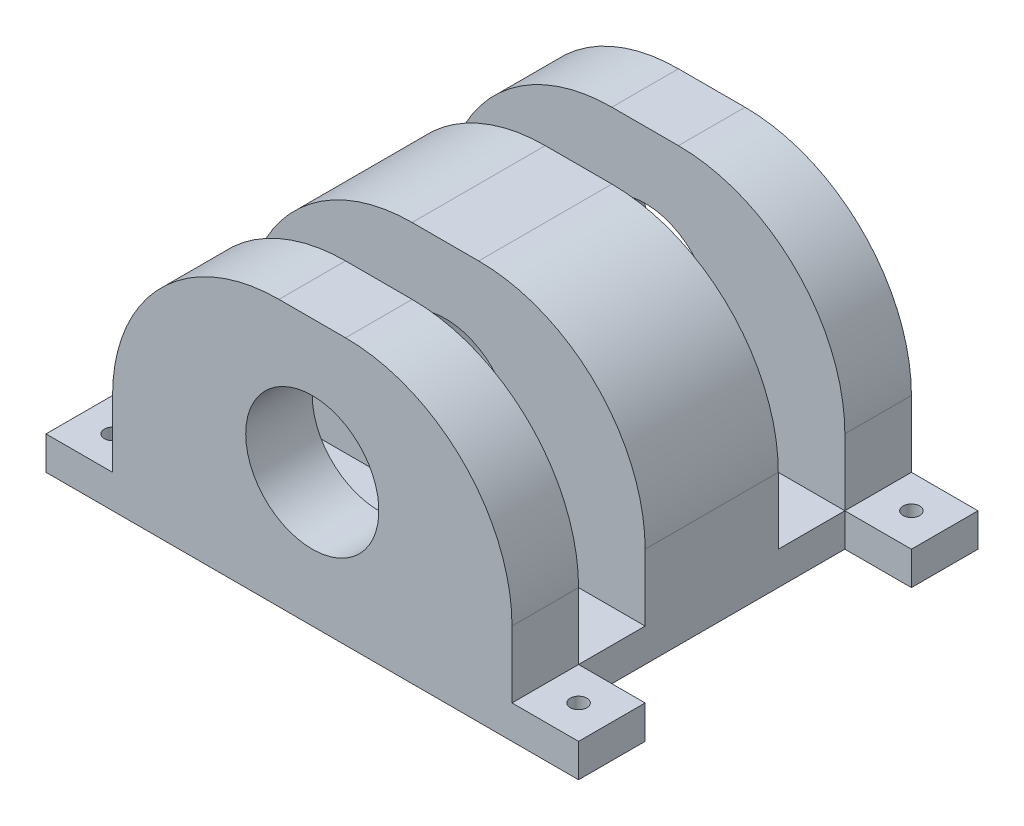
from build123d import *

# Parameters (mm, degrees)
SKETCH1_R                   = 25.4
BOSS_EXTRUDE1_DEPTH         = 152.4
CUT_EXTRUDE1_DEPTH          = 191.076195248
CUT_EXTRUDE1_DEPTH_BACK     = 191.076195248
SKETCH3_W                   = 25.4
SKETCH3_H                   = 88.9
F_1_4_0_25_DIAMETER_HOLE1_D = 6.35
SKETCH4_W                   = 25.4
SKETCH4_H                   = 101.6
CUT_EXTRUDE2_DEPTH          = 204.596488182


with BuildPart() as part:
    # Sketch1 → Boss-Extrude1 (new body)
    with BuildSketch(Plane.XY):
        with BuildLine():
            Line((-76.2, -50.8), (76.2, -50.8))
            Line((76.2, -50.8), (101.6, -50.8))
            Line((101.6, -50.8), (101.6, -38.1))
            Line((101.6, -38.1), (76.2, -38.1))
            Line((76.2, -38.1), (76.2, -12.7))
            ThreePointArc((76.2, -12.7), (57.601280605, 32.201280605), (12.7, 50.8))
            Line((12.7, 50.8), (-12.7, 50.8))
            ThreePointArc((-12.7, 50.8), (-57.601280605, 32.201280605), (-76.2, -12.7))
            Line((-76.2, -12.7), (-76.2, -38.1))
            Line((-76.2, -38.1), (-101.6, -38.1))
            Line((-101.6, -38.1), (-101.6, -50.8))
            Line((-101.6, -50.8), (-76.2, -50.8))
        make_face()
        Circle(SKETCH1_R, mode=Mode.SUBTRACT)
    extrude(amount=BOSS_EXTRUDE1_DEPTH)

    # Sketch3 → Cut-Extrude1 (cut, two sides: drawn at the far end of the back side and taken through both)
    with BuildSketch(Plane(origin=(0, 0, 0), x_dir=(0, 0, -1), z_dir=(1, 0, 0)).offset(-CUT_EXTRUDE1_DEPTH_BACK)):
        with Locations((-114.3, 6.35)):
            Rectangle(SKETCH3_W, SKETCH3_H)
        with Locations((-38.1, 6.35)):
            Rectangle(SKETCH3_W, SKETCH3_H)
    extrude(amount=CUT_EXTRUDE1_DEPTH + CUT_EXTRUDE1_DEPTH_BACK, mode=Mode.SUBTRACT)

    # 1/4 (0.25) Diameter Hole1 (through all)
    with Locations(Plane(origin=(0, -38.1, 0), x_dir=(1, 0, 0), z_dir=(0, 1, 0))):
        with Locations((-88.9, -12.7), (-88.9, -139.7), (88.9, -12.7), (88.9, -139.7)):
            Hole(F_1_4_0_25_DIAMETER_HOLE1_D / 2)

    # Sketch4 → Cut-Extrude2 (cut, through all)
    with BuildSketch(Plane(origin=(0, -38.1, 0), x_dir=(1, 0, 0), z_dir=(0, 1, 0))):
        with Locations((-88.9, -76.2)):
            Rectangle(SKETCH4_W, SKETCH4_H)
        with Locations((88.9, -76.2)):
            Rectangle(SKETCH4_W, SKETCH4_H)
    extrude(amount=-CUT_EXTRUDE2_DEPTH, mode=Mode.SUBTRACT)


solid = part.part
